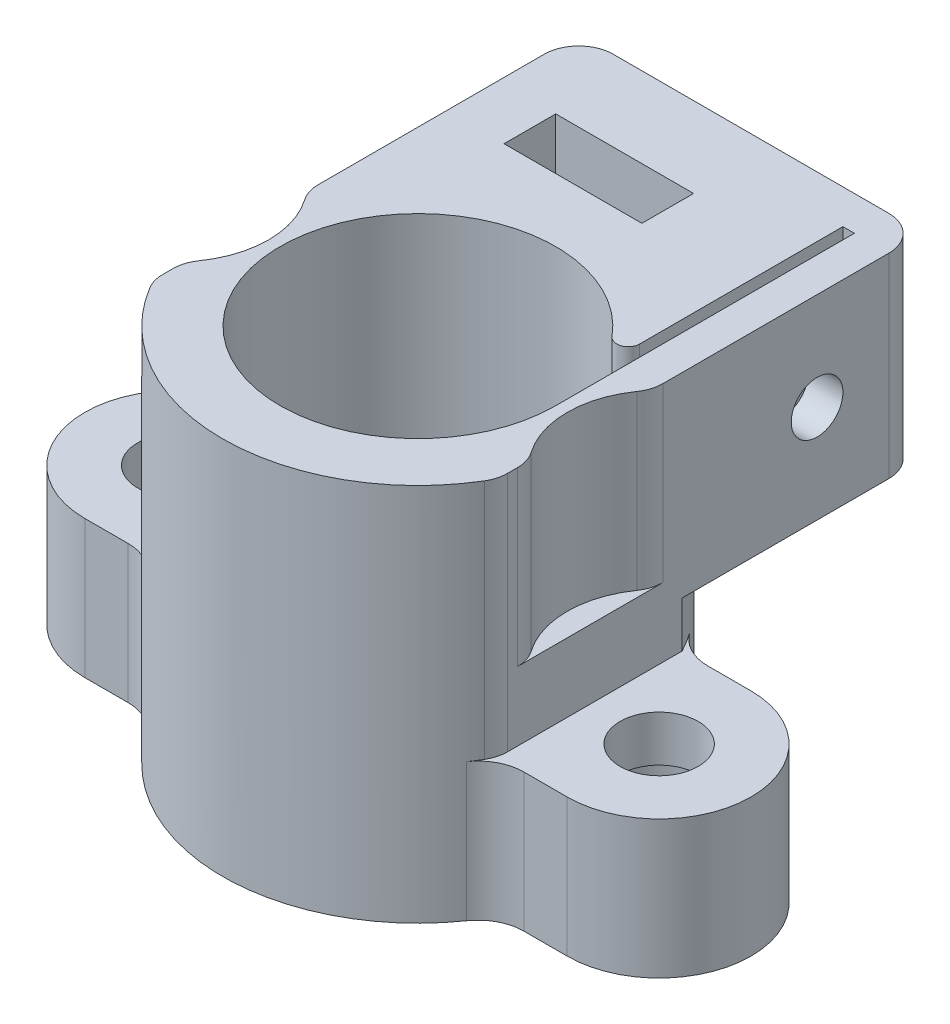
from build123d import *
from build123d.topology import SkipClean

# Parameters (mm, degrees)
BOSS_EXTRU_1_START      = -6
BOSS_EXTRU_1_DEPTH      = 6
BOSS_EXTRU_2_START      = -6
BOSS_EXTRU_2_DEPTH      = 2
ENL_V_START             = -4
ESQUISSE3_5_R           = 2.55
ENL_V_MAT_EXTRU_1_DEPTH = 4
ENL_V_START_2           = -16.5
ENL_V_MAT_EXTRU_5_DEPTH = 10.5
CONG_1_R                = 2
CHANFREIN1_SIZE         = 0.5
SYM_TRIE1_START         = -2
SYM_TRIE1_DEPTH         = 10.5
SYM_TRIE1_START_2       = -8
SYM_TRIE1_2_DEPTH       = 4
SYM_TRIE1_START_3       = -7.5000001
SYM_TRIE1_3_DEPTH       = 5.5000001
SYM_TRIE1_START_4       = -4
SYM_TRIE1_4_DEPTH       = 2
SYM_TRIE1_7_DEPTH       = 0.4999999
M3_CLEARANCE_HOLE1_D    = 3.4
BOSS_EXTRU_3_DEPTH      = 8.5
ENL_V_START_3           = -8.5
ENL_V_MAT_EXTRU_2_DEPTH = 8.5
ENL_V_START_4           = -6.5
ESQUISSE5_R             = 1.125
ENL_V_MAT_EXTRU_3_DEPTH = 6
ESQUISSE5_3_R           = 1.125
ENL_V_MAT_EXTRU_4_DEPTH = 6.5
CONG_2_R                = 0.5
CONG_3_R                = 1.5
ENL_V_START_5           = -7.5
ESQUISSE9_R             = 4
ENL_V_MAT_EXTRU_8_DEPTH = 7.5
CONG_5_R                = 1.5


with BuildPart() as part:
    # Esquisse1 → Révolution1 (revolve)
    with BuildSketch(Plane.XY):
        Polygon((-8.5, 8.5), (-6, 8.5), (-6, 0), (-3.5, 0), (-3.5, -1), (-4.383974596, -1), (-5.25, -1.5), (-6.5, -1.5), (-6.5, -6.5), (-6.8, -6.5), (-6.8, -7.2), (-6.5, -7.2), (-6.5, -8), (-8.5, -8), align=None)
    revolve(axis=Axis((0, 6.43509573, 0), (0, -1, 0)))

    # Esquisse3 → Boss.-Extru.1 (add)
    with BuildSketch(Plane.XZ.offset(8).offset(BOSS_EXTRU_1_START)):
        with BuildLine():
            ThreePointArc((-7.928571429, 3.06394437), (-7.728470361, 3.5384666), (-7.5, 4))
            Line((-7.5, 4), (-10.5, 4))
            ThreePointArc((-10.5, 4), (-14.5, 0), (-10.5, -4))
            Line((-10.5, -4), (-7.5, -4))
            ThreePointArc((-7.5, -4), (-7.728470361, -3.5384666), (-7.928571429, -3.06394437))
            ThreePointArc((-7.928571429, -3.06394437), (-8.196108254, -2.252511816), (-8.380833333, -1.418320358))
            ThreePointArc((-8.380833333, -1.418320358), (-13.05, 0), (-8.380833333, 1.418320358))
            ThreePointArc((-8.380833333, 1.418320358), (-8.196108254, 2.252511816), (-7.928571429, 3.06394437))
        make_face()
    extrude(amount=BOSS_EXTRU_1_DEPTH)

    # Esquisse3<4> → Boss.-Extru.2 (add)
    with BuildSketch(Plane.XZ.offset(8).offset(BOSS_EXTRU_2_START)):
        with BuildLine():
            ThreePointArc((-8.380833333, -1.418320358), (-8.5, 0), (-8.380833333, 1.418320358))
            ThreePointArc((-8.380833333, 1.418320358), (-13.05, 0), (-8.380833333, -1.418320358))
        make_face()
    extrude(amount=BOSS_EXTRU_2_DEPTH)

    # Esquisse3<5> → Enlèv. mat.-Extru.1 (cut)
    with BuildSketch(Plane.XZ.offset(8).offset(ENL_V_START)):
        with Locations((-10.5, 0)):
            Circle(ESQUISSE3_5_R)
    extrude(amount=ENL_V_MAT_EXTRU_1_DEPTH, mode=Mode.SUBTRACT)

    # Esquisse3<7> → Enlèv. mat.-Extru.5 (cut)
    with BuildSketch(Plane.XZ.offset(8).offset(ENL_V_START_2)):
        with BuildLine():
            ThreePointArc((-7.5, 4), (-8.5, 0), (-7.5, -4))
            Line((-7.5, -4), (-7.5, 4))
        make_face()
    extrude(amount=ENL_V_MAT_EXTRU_5_DEPTH, mode=Mode.SUBTRACT)

    # Congé1
    cong_1_edges = [part.edges().sort_by_distance(p)[0] for p in [
        (-7.5, -5, 4),
        (-7.5, -5, -4),
    ]]
    fillet(cong_1_edges, radius=CONG_1_R)

    # Chanfrein1
    chanfrein1_edges = [part.edges().sort_by_distance(p)[0] for p in [
        (-8.06008453, -8, 0.741156191),
    ]]
    chamfer(chanfrein1_edges, length=CHANFREIN1_SIZE)

    # Symétrie1: read off the stored shape, not the designer's step
    # Symétrie1 outline → Symétrie1 (cut)
    with BuildSketch(Plane(origin=(0, 0, 0), x_dir=(1, 0, 0), z_dir=(0, 1, 0)).offset(SYM_TRIE1_START)):
        with BuildLine():
            Line((7.5, 4), (7.5, -4))
            ThreePointArc((7.5, -4), (8.5, 0), (7.5, 4))
        make_face()
    extrude(amount=SYM_TRIE1_DEPTH, mode=Mode.SUBTRACT)

    # Sym_trie1 2 outline → Sym_trie1 2 (cut)
    with BuildSketch(Plane(origin=(0, 0, 0), x_dir=(1, 0, 0), z_dir=(0, 1, 0)).offset(SYM_TRIE1_START_2)):
        with BuildLine():
            ThreePointArc((8.380833333, 1.418320358), (7.95, 0), (8.380833333, -1.418320358))
            ThreePointArc((8.380833333, -1.418320358), (8.5, 0), (8.380833333, 1.418320358))
        make_face()
    extrude(amount=SYM_TRIE1_2_DEPTH, mode=Mode.SUBTRACT)

    # Sym_trie1 3 outline → Sym_trie1 3 (add)
    with BuildSketch(Plane(origin=(0, 0, 0), x_dir=(1, 0, 0), z_dir=(0, 1, 0)).offset(SYM_TRIE1_START_3)):
        with BuildLine():
            ThreePointArc((6.975540357, -4.857142857), (7.69102387, -4.227189479), (8.61684397, -4))
            Line((8.61684397, -4), (10.5, -4))
            ThreePointArc((10.5, -4), (14.5, 0), (10.5, 4))
            Line((10.5, 4), (8.61684397, 4))
            ThreePointArc((8.61684397, 4), (7.69102387, 4.227189479), (6.975540357, 4.857142857))
            ThreePointArc((6.975540357, 4.857142857), (7.868349781, 3.215442696), (8.380833333, 1.418320358))
            ThreePointArc((8.380833333, 1.418320358), (13.05, 0), (8.380833333, -1.418320358))
            ThreePointArc((8.380833333, -1.418320358), (7.868349781, -3.215442696), (6.975540357, -4.857142857))
        make_face()
    extrude(amount=SYM_TRIE1_3_DEPTH)

    # Sym_trie1 4 outline → Sym_trie1 4 (add)
    with BuildSketch(Plane(origin=(0, 0, 0), x_dir=(1, 0, 0), z_dir=(0, 1, 0)).offset(SYM_TRIE1_START_4)):
        with BuildLine():
            ThreePointArc((8.380833333, 1.418320358), (8.5, 0), (8.380833333, -1.418320358))
            ThreePointArc((8.380833333, -1.418320358), (13.05, 0), (8.380833333, 1.418320358))
        make_face()
    extrude(amount=SYM_TRIE1_4_DEPTH)

    # Sym_trie1 5 outline → Sym_trie1 5 (revolve, cut)
    with BuildSketch(Plane(origin=(10.5, 0, 0), x_dir=(1, 0, 0), z_dir=(0, 0, 1))):
        Polygon((3.05, -8), (2.55, -7.5), (2.55, -8), align=None)
    revolve(axis=Axis((10.5, 0, 0), (0, 1, 0)), mode=Mode.SUBTRACT)

    # Sym_trie1 6 outline → Sym_trie1 6 (revolve)
    with SkipClean():  # the faces are left unmerged after this step: merging them gives an invalid solid
        with BuildSketch(Plane(origin=(10.5, 0, 0), x_dir=(1, 0, 0), z_dir=(0, 0, 1))):
            Polygon((3.05, -7.5), (2.55, -7.5), (3.05, -8), align=None)
        revolve(axis=Axis((10.5, 0, 0), (0, 1, 0)))

    # Sym_trie1 7 outline → Sym_trie1 7 (add)
    with BuildSketch(Plane(origin=(0, 0, 0), x_dir=(1, 0, 0), z_dir=(0, 1, 0)).offset(SYM_TRIE1_START_2)):
        with BuildLine():
            ThreePointArc((8.2475, 2.056390953), (13.55, 0), (8.2475, -2.056390953))
            ThreePointArc((8.2475, -2.056390953), (7.933495012, -3.051173035), (7.5, -4))
            ThreePointArc((7.5, -4), (7.250447615, -4.436328367), (6.975540357, -4.857142857))
            ThreePointArc((6.975540357, -4.857142857), (7.69102387, -4.227189479), (8.61684397, -4))
            Line((8.61684397, -4), (10.5, -4))
            ThreePointArc((10.5, -4), (14.5, 0), (10.5, 4))
            Line((10.5, 4), (8.61684397, 4))
            ThreePointArc((8.61684397, 4), (7.69102387, 4.227189479), (6.975540357, 4.857142857))
            ThreePointArc((6.975540357, 4.857142857), (7.250447615, 4.436328367), (7.5, 4))
            ThreePointArc((7.5, 4), (7.933495012, 3.051173035), (8.2475, 2.056390953))
        make_face()
    extrude(amount=SYM_TRIE1_7_DEPTH)

    # M3 Clearance Hole1 (through all)
    with Locations(Plane(origin=(0, -4, 0), x_dir=(-1, 0, 0), z_dir=(0, -1, 0))):
        with Locations((10.5, 0), (-10.5, 0)):
            Hole(M3_CLEARANCE_HOLE1_D / 2)

    # Esquisse4 → Boss.-Extru.3 (add)
    with BuildSketch(Plane(origin=(0, 8.5, 0), x_dir=(1, 0, 0), z_dir=(0, 1, 0))):
        with BuildLine():
            Line((7.5, 14.5), (-7.5, 14.5))
            Line((-7.5, 14.5), (-7.5, 4))
            ThreePointArc((-7.5, 4), (-1.593272922, 8.349340177), (5.5, 6.480740698))
            Line((5.5, 6.480740698), (5.5, 13))
            Line((5.5, 13), (6, 13))
            Line((6, 13), (6, 6.020797289))
            ThreePointArc((6, 6.020797289), (6.825203691, 5.066220937), (7.5, 4))
            Line((7.5, 4), (7.5, 14.5))
        make_face()
    extrude(amount=-BOSS_EXTRU_3_DEPTH)

    # Esquisse4<3> → Enlèv. mat.-Extru.2 (cut)
    with BuildSketch(Plane(origin=(0, 8.5, 0), x_dir=(1, 0, 0), z_dir=(0, 1, 0)).offset(ENL_V_START_3)):
        with BuildLine():
            Line((6, 0), (6, 13))
            Line((6, 13), (5.5, 13))
            Line((5.5, 13), (5.5, 2.397915762))
            ThreePointArc((5.5, 2.397915762), (5.873670062, 1.224744871), (6, 0))
        make_face()
    extrude(amount=ENL_V_MAT_EXTRU_2_DEPTH, mode=Mode.SUBTRACT)

    # Esquisse5 → Enlèv. mat.-Extru.3 (cut)
    with BuildSketch(Plane(origin=(7.5, 0, 0), x_dir=(0, 0, -1), z_dir=(1, 0, 0)).offset(ENL_V_START_4)):
        with Locations((9.875, 4.2554)):
            Circle(ESQUISSE5_R)
        with BuildLine():
            Line((8.75, 8.5), (8.75, 4.2554))
            ThreePointArc((8.75, 4.2554), (9.875, 5.3804), (11, 4.2554))
            Line((11, 4.2554), (11, 8.5))
            Line((11, 8.5), (8.75, 8.5))
        make_face()
    extrude(amount=-ENL_V_MAT_EXTRU_3_DEPTH, mode=Mode.SUBTRACT)

    # Esquisse5<3> → Enlèv. mat.-Extru.4 (cut)
    with BuildSketch(Plane(origin=(7.5, 0, 0), x_dir=(0, 0, -1), z_dir=(1, 0, 0))):
        with Locations(Location((9.875, 4.2554, 0), (0, 0, 180))):
            Circle(ESQUISSE5_3_R)
    extrude(amount=-ENL_V_MAT_EXTRU_4_DEPTH, mode=Mode.SUBTRACT)

    # Congé2
    # the kernel refuses this fillet: 0.5 mm, written as the material it takes off along each edge
    with BuildSketch(Plane(origin=(5.5, 0, -2.397915762), x_dir=(0, 0, -1), z_dir=(0, 1, 0))) as cong_2_piece_1:
        with BuildLine():
            CenterArc((1.75539617, 0.5), CONG_2_R, 129.715137232, 140.284862768)
            ThreePointArc((1.435910637, 0.884615385), (0.749192225, 0.391603841), (0, 0))
            Line((0, 0), (1.75539617, 0))
        make_face()
    extrude(amount=12.888490425, mode=Mode.SUBTRACT)

    # Congé3
    cong_3_edges = [part.edges().sort_by_distance(p)[0] for p in [
        (7.5, 3.25, 4),
        (7.5, 4.25, -14.5),
        (-7.5, 4.25, -14.5),
        (-7.5, 3.25, 4),
    ]]
    fillet(cong_3_edges, radius=CONG_3_R)

    # Esquisse9 → Enlèv. mat.-Extru.8 (cut)
    with BuildSketch(Plane(origin=(0, 8.5, 0), x_dir=(1, 0, 0), z_dir=(0, 1, 0)).offset(ENL_V_START_5)):
        with Locations((-10.5, 0)):
            Circle(ESQUISSE9_R)
        with Locations((10.5, 0)):
            Circle(ESQUISSE9_R)
    extrude(amount=ENL_V_MAT_EXTRU_8_DEPTH, mode=Mode.SUBTRACT)

    # Congé5
    cong_5_edges = [part.edges().sort_by_distance(p)[0] for p in [
        (7.5, 4.75, -2.645751311),
        (7.5, 4.75, 2.645751311),
        (-7.5, 4.75, -2.645751311),
        (-7.5, 4.75, 2.645751311),
    ]]
    fillet(cong_5_edges, radius=CONG_5_R)


solid = part.part
